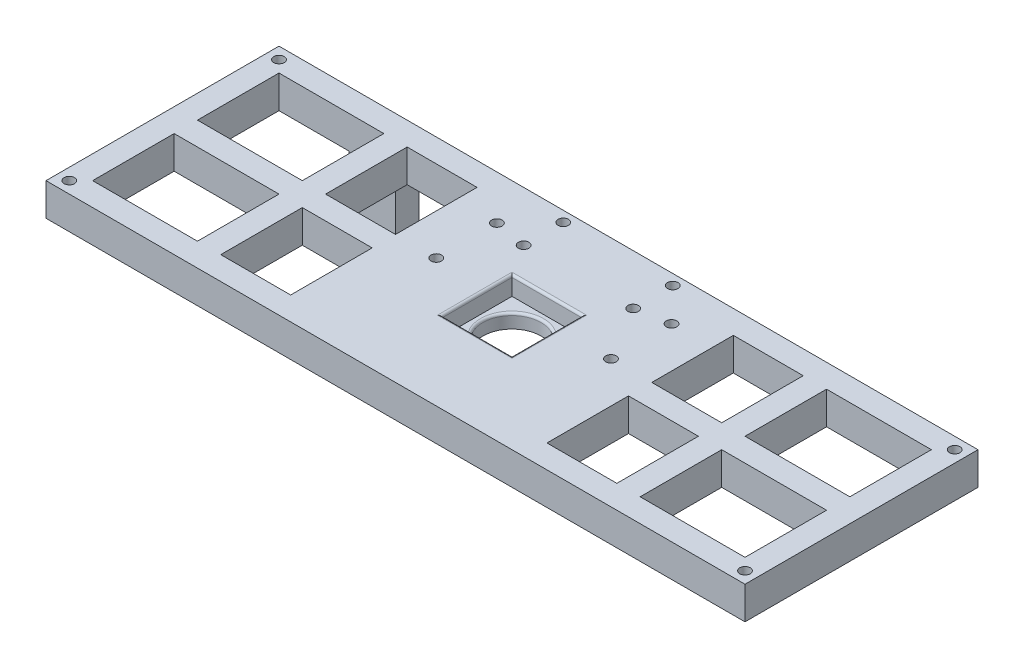
from build123d import *

# Parameters (mm, degrees)
SKETCH_1_W           = 300
SKETCH_1_H           = 100
EXTRUDE_1_DEPTH      = 16
SKETCH_2_W           = 30
SKETCH_2_H           = 30
CUT_EXTRUDE_1_DEPTH  = 8
SKETCH_3_R           = 12.5
CUT_EXTRUDE_2_DEPTH  = 14
CUT_EXTRUDE_3_REACH  = 318.632
SKETCH_4_W           = 50
SKETCH_4_H           = 35
SKETCH_7_W           = 35
SKETCH_7_H           = 16
EXTRUDE_2_DEPTH      = 20
SKETCH_8_W           = 35
SKETCH_8_H           = 16
EXTRUDE_3_DEPTH      = 20
SKETCH_9_W           = 20
SKETCH_9_H           = 10
EXTRUDE_4_DEPTH      = 25
FILLET_1_R           = 1
FILLET_2_R           = 1
SKETCH_13_W          = 35
SKETCH_13_H          = 16
EXTRUDE_6_DEPTH      = 4
SKETCH_14_W          = 35
SKETCH_14_H          = 16
EXTRUDE_7_DEPTH      = 4
SKETCH_17_W          = 35
SKETCH_17_H          = 16
EXTRUDE_8_DEPTH      = 1
SKETCH_18_W          = 35
SKETCH_18_H          = 16
EXTRUDE_9_DEPTH      = 1
SKETCH_19_R          = 2.25
CUT_EXTRUDE_8_DEPTH  = 5
CUT_EXTRUDE_START    = -7
SKETCH_20_R          = 2.25
CUT_EXTRUDE_9_DEPTH  = 7
SKETCH_21_R          = 1.45
CUT_EXTRUDE_10_DEPTH = 5
SKETCH_22_R          = 2.25
CUT_EXTRUDE_11_DEPTH = 5
SKETCH_23_R          = 1.45
CUT_EXTRUDE_12_DEPTH = 5
SKETCH_24_R          = 2.25
CUT_EXTRUDE_13_DEPTH = 5
CUT_EXTRUDE_15_DEPTH = 2
SKETCH_27_R          = 1.5
CUT_EXTRUDE_16_DEPTH = 4


with BuildPart() as part:
    # 草图1 → 凸台-拉伸1 (new body)
    with BuildSketch(Plane(origin=(0, 0, 0), x_dir=(1, 0, 0), z_dir=(0, 1, 0))):
        with Locations((-150, 50)):
            Rectangle(SKETCH_1_W, SKETCH_1_H)
    extrude(amount=EXTRUDE_1_DEPTH)

    # 草图2 → 切除-拉伸1 (cut)
    with BuildSketch(Plane(origin=(0, 16, 0), x_dir=(1, 0, 0), z_dir=(0, 1, 0))):
        with Locations((-150, 50)):
            Rectangle(SKETCH_2_W, SKETCH_2_H)
    extrude(amount=-CUT_EXTRUDE_1_DEPTH, mode=Mode.SUBTRACT)

    # 草图3 → 切除-拉伸2 (cut)
    with BuildSketch(Plane(origin=(0, 8, 0), x_dir=(1, 0, 0), z_dir=(0, 1, 0))):
        with Locations((-150, 50)):
            Circle(SKETCH_3_R)
    extrude(amount=-CUT_EXTRUDE_2_DEPTH, mode=Mode.SUBTRACT)

    # 草图4 → 切除-拉伸3 (cut, up to next)
    with BuildSketch(Plane(origin=(0, 16, 0), x_dir=(1, 0, 0), z_dir=(0, 1, 0)), mode=Mode.PRIVATE) as cut_extrude_3_sk1:
        with Locations((-270, 72.5)):
            Rectangle(SKETCH_4_W, SKETCH_4_H)
    cut_extrude_3_tool1 = extrude(cut_extrude_3_sk1.sketch, amount=-CUT_EXTRUDE_3_REACH, mode=Mode.PRIVATE) & part.part
    # 草图4 → 切除-拉伸3 (cut, up to next)
    with BuildSketch(Plane(origin=(0, 16, 0), x_dir=(1, 0, 0), z_dir=(0, 1, 0)), mode=Mode.PRIVATE) as cut_extrude_3_sk2:
        with Locations((-270, 27.5)):
            Rectangle(SKETCH_4_W, SKETCH_4_H)
    cut_extrude_3_tool2 = extrude(cut_extrude_3_sk2.sketch, amount=-CUT_EXTRUDE_3_REACH, mode=Mode.PRIVATE) & part.part
    # 草图4 → 切除-拉伸3 (cut, up to next)
    with BuildSketch(Plane(origin=(0, 16, 0), x_dir=(1, 0, 0), z_dir=(0, 1, 0)), mode=Mode.PRIVATE) as cut_extrude_3_sk3:
        with Locations((-210, 72.5)):
            Rectangle(SKETCH_4_W, SKETCH_4_H)
    cut_extrude_3_tool3 = extrude(cut_extrude_3_sk3.sketch, amount=-CUT_EXTRUDE_3_REACH, mode=Mode.PRIVATE) & part.part
    # 草图4 → 切除-拉伸3 (cut, up to next)
    with BuildSketch(Plane(origin=(0, 16, 0), x_dir=(1, 0, 0), z_dir=(0, 1, 0)), mode=Mode.PRIVATE) as cut_extrude_3_sk4:
        with Locations((-210, 27.5)):
            Rectangle(SKETCH_4_W, SKETCH_4_H)
    cut_extrude_3_tool4 = extrude(cut_extrude_3_sk4.sketch, amount=-CUT_EXTRUDE_3_REACH, mode=Mode.PRIVATE) & part.part
    # 草图4 → 切除-拉伸3 (cut, up to next)
    with BuildSketch(Plane(origin=(0, 16, 0), x_dir=(1, 0, 0), z_dir=(0, 1, 0)), mode=Mode.PRIVATE) as cut_extrude_3_sk5:
        with Locations((-30, 27.5)):
            Rectangle(SKETCH_4_W, SKETCH_4_H)
    cut_extrude_3_tool5 = extrude(cut_extrude_3_sk5.sketch, amount=-CUT_EXTRUDE_3_REACH, mode=Mode.PRIVATE) & part.part
    # 草图4 → 切除-拉伸3 (cut, up to next)
    with BuildSketch(Plane(origin=(0, 16, 0), x_dir=(1, 0, 0), z_dir=(0, 1, 0)), mode=Mode.PRIVATE) as cut_extrude_3_sk6:
        with Locations((-90, 27.5)):
            Rectangle(SKETCH_4_W, SKETCH_4_H)
    cut_extrude_3_tool6 = extrude(cut_extrude_3_sk6.sketch, amount=-CUT_EXTRUDE_3_REACH, mode=Mode.PRIVATE) & part.part
    # 草图4 → 切除-拉伸3 (cut, up to next)
    with BuildSketch(Plane(origin=(0, 16, 0), x_dir=(1, 0, 0), z_dir=(0, 1, 0)), mode=Mode.PRIVATE) as cut_extrude_3_sk7:
        with Locations((-90, 72.5)):
            Rectangle(SKETCH_4_W, SKETCH_4_H)
    cut_extrude_3_tool7 = extrude(cut_extrude_3_sk7.sketch, amount=-CUT_EXTRUDE_3_REACH, mode=Mode.PRIVATE) & part.part
    # 草图4 → 切除-拉伸3 (cut, up to next)
    with BuildSketch(Plane(origin=(0, 16, 0), x_dir=(1, 0, 0), z_dir=(0, 1, 0)), mode=Mode.PRIVATE) as cut_extrude_3_sk8:
        with Locations((-30, 72.5)):
            Rectangle(SKETCH_4_W, SKETCH_4_H)
    cut_extrude_3_tool8 = extrude(cut_extrude_3_sk8.sketch, amount=-CUT_EXTRUDE_3_REACH, mode=Mode.PRIVATE) & part.part
    add(cut_extrude_3_tool1.solids().sort_by_distance((-270, 16, -72.5))[0], mode=Mode.SUBTRACT)
    add(cut_extrude_3_tool2.solids().sort_by_distance((-270, 16, -27.5))[0], mode=Mode.SUBTRACT)
    add(cut_extrude_3_tool3.solids().sort_by_distance((-210, 16, -72.5))[0], mode=Mode.SUBTRACT)
    add(cut_extrude_3_tool4.solids().sort_by_distance((-210, 16, -27.5))[0], mode=Mode.SUBTRACT)
    add(cut_extrude_3_tool5.solids().sort_by_distance((-30, 16, -27.5))[0], mode=Mode.SUBTRACT)
    add(cut_extrude_3_tool6.solids().sort_by_distance((-90, 16, -27.5))[0], mode=Mode.SUBTRACT)
    add(cut_extrude_3_tool7.solids().sort_by_distance((-90, 16, -72.5))[0], mode=Mode.SUBTRACT)
    add(cut_extrude_3_tool8.solids().sort_by_distance((-30, 16, -72.5))[0], mode=Mode.SUBTRACT)

    # 草图7 → 凸台-拉伸2 (add)
    with BuildSketch(Plane.ZY.offset(185)):
        with Locations((-27.5, 8)):
            Rectangle(SKETCH_7_W, SKETCH_7_H)
        with Locations((-72.5, 8)):
            Rectangle(SKETCH_7_W, SKETCH_7_H)
    extrude(amount=EXTRUDE_2_DEPTH)

    # 草图8 → 凸台-拉伸3 (add)
    with BuildSketch(Plane(origin=(-115, 0, 0), x_dir=(0, 0, -1), z_dir=(1, 0, 0))):
        with Locations((27.5, 8)):
            Rectangle(SKETCH_8_W, SKETCH_8_H)
        with Locations((72.5, 8)):
            Rectangle(SKETCH_8_W, SKETCH_8_H)
    extrude(amount=EXTRUDE_3_DEPTH)

    # 草图9 → 凸台-拉伸4 (add)
    with BuildSketch(Plane.XZ):
        with Locations((-250, -95)):
            Rectangle(SKETCH_9_W, SKETCH_9_H)
    extrude(amount=EXTRUDE_4_DEPTH)

    # 圆角1
    fillet_1_edges = [part.edges().sort_by_distance(p)[0] for p in [
        (-162.5, 8, -50),
    ]]
    fillet(fillet_1_edges, radius=FILLET_1_R)

    # 圆角2
    fillet_2_edges = [part.edges().sort_by_distance(p)[0] for p in [
        (-135, 16, -50),
        (-150, 16, -65),
        (-150, 16, -35),
        (-165, 16, -50),
    ]]
    fillet(fillet_2_edges, radius=FILLET_2_R)

    # 草图13 → 凸台-拉伸6 (add)
    with BuildSketch(Plane.ZY.offset(5)):
        with Locations((-72.5, 8)):
            Rectangle(SKETCH_13_W, SKETCH_13_H)
        with Locations((-27.5, 8)):
            Rectangle(SKETCH_13_W, SKETCH_13_H)
    extrude(amount=EXTRUDE_6_DEPTH)

    # 草图14 → 凸台-拉伸7 (add)
    with BuildSketch(Plane(origin=(-295, 0, 0), x_dir=(0, 0, -1), z_dir=(1, 0, 0))):
        with Locations((72.5, 8)):
            Rectangle(SKETCH_14_W, SKETCH_14_H)
        with Locations((27.5, 8)):
            Rectangle(SKETCH_14_W, SKETCH_14_H)
    extrude(amount=EXTRUDE_7_DEPTH)

    # 草图17 → 凸台-拉伸8 (add)
    with BuildSketch(Plane(origin=(-291, 0, 0), x_dir=(0, 0, -1), z_dir=(1, 0, 0))):
        with Locations((27.5, 8)):
            Rectangle(SKETCH_17_W, SKETCH_17_H)
        with Locations((72.5, 8)):
            Rectangle(SKETCH_17_W, SKETCH_17_H)
    extrude(amount=EXTRUDE_8_DEPTH)

    # 草图18 → 凸台-拉伸9 (add)
    with BuildSketch(Plane.ZY.offset(9)):
        with Locations((-27.5, 8)):
            Rectangle(SKETCH_18_W, SKETCH_18_H)
        with Locations((-72.5, 8)):
            Rectangle(SKETCH_18_W, SKETCH_18_H)
    extrude(amount=EXTRUDE_9_DEPTH)

    # 草图19 → 切除-拉伸8 (cut)
    with BuildSketch(Plane(origin=(0, 16, 0), x_dir=(1, 0, 0), z_dir=(0, 1, 0))):
        with Locations((-295, 95)):
            Circle(SKETCH_19_R)
        with Locations((-295, 5)):
            Circle(SKETCH_19_R)
        with Locations((-5, 5)):
            Circle(SKETCH_19_R)
        with Locations((-5, 95)):
            Circle(SKETCH_19_R)
    extrude(amount=-CUT_EXTRUDE_8_DEPTH, mode=Mode.SUBTRACT)

    # 草图20 → 切除-拉伸9 (cut)
    with BuildSketch(Plane.XZ.offset(CUT_EXTRUDE_START)):
        with Locations((-295, -95)):
            Circle(SKETCH_20_R)
        with Locations((-295, -5)):
            Circle(SKETCH_20_R)
        with Locations((-5, -95)):
            Circle(SKETCH_20_R)
        with Locations((-5, -5)):
            Circle(SKETCH_20_R)
    extrude(amount=CUT_EXTRUDE_9_DEPTH, mode=Mode.SUBTRACT)

    # 草图21 → 切除-拉伸10 (cut)
    with BuildSketch(Plane(origin=(-100.276222054, 16, -200.091791604), x_dir=(-0.00184091553368713, 0, -0.9999983055135633), z_dir=(0, 1, 0))):
        with Locations((-104.543338614, 26.416278164)):
            Circle(SKETCH_21_R)
        with Locations((-121.543309808, 26.447573728)):
            Circle(SKETCH_21_R)
        with Locations((-121.456786778, 73.447494087)):
            Circle(SKETCH_21_R)
        with Locations((-104.456815584, 73.416198523)):
            Circle(SKETCH_21_R)
    extrude(amount=-CUT_EXTRUDE_10_DEPTH, mode=Mode.SUBTRACT)

    # 草图22 → 切除-拉伸11 (cut)
    with BuildSketch(Plane(origin=(0, 16, 0), x_dir=(1, 0, 0), z_dir=(0, 1, 0))):
        with Locations((-173.5, 95.5)):
            Circle(SKETCH_22_R)
        with Locations((-173.5, 78.5)):
            Circle(SKETCH_22_R)
        with Locations((-126.5, 95.5)):
            Circle(SKETCH_22_R)
        with Locations((-126.5, 78.5)):
            Circle(SKETCH_22_R)
    extrude(amount=-CUT_EXTRUDE_11_DEPTH, mode=Mode.SUBTRACT)

    # 草图23 → 切除-拉伸12 (cut)
    with BuildSketch(Plane(origin=(-100.276222054, 16, -200.091791604), x_dir=(-0.00184091553368713, 0, -0.9999983055135633), z_dir=(0, 1, 0))):
        with Locations((-119.069051565, 12.462168574)):
            Circle(SKETCH_23_R)
        with Locations((-145.069007508, 12.510032378)):
            Circle(SKETCH_23_R)
        with Locations((-144.931009437, 87.471558467)):
            Circle(SKETCH_23_R)
        with Locations((-118.931053493, 87.423694663)):
            Circle(SKETCH_23_R)
    extrude(amount=-CUT_EXTRUDE_12_DEPTH, mode=Mode.SUBTRACT)

    # 草图24 → 切除-拉伸13 (cut)
    with BuildSketch(Plane(origin=(0, 16, 0), x_dir=(1, 0, 0), z_dir=(0, 1, 0))):
        with Locations((-187.480826555, 81)):
            Circle(SKETCH_24_R)
        with Locations((-187.480826555, 55)):
            Circle(SKETCH_24_R)
        with Locations((-112.519173445, 81)):
            Circle(SKETCH_24_R)
        with Locations((-112.519173445, 55)):
            Circle(SKETCH_24_R)
    extrude(amount=-CUT_EXTRUDE_13_DEPTH, mode=Mode.SUBTRACT)

    # 草图26 → 切除-拉伸15 (cut)
    with BuildSketch(Plane.XZ):
        Polygon((-260, -90), (-290, -90), (-290, -55), (-245, -55), (-245, -90), (-240, -90), (-240, -100), (0, -100), (0, 0), (-300, 0), (-300, -100), (-260, -100), align=None)
    extrude(amount=-CUT_EXTRUDE_15_DEPTH, mode=Mode.SUBTRACT)

    # 草图27 → 切除-拉伸16 (cut)
    with BuildSketch(Plane(origin=(0, 11, 0), x_dir=(1, 0, 0), z_dir=(0, 1, 0))):
        with Locations((-173.5, 95.5)):
            Circle(SKETCH_27_R)
        with Locations((-187.480826555, 81)):
            Circle(SKETCH_27_R)
        with Locations((-173.5, 78.5)):
            Circle(SKETCH_27_R)
        with Locations((-126.5, 95.5)):
            Circle(SKETCH_27_R)
        with Locations((-126.5, 78.5)):
            Circle(SKETCH_27_R)
        with Locations((-187.480826555, 55)):
            Circle(SKETCH_27_R)
        with Locations((-112.519173445, 55)):
            Circle(SKETCH_27_R)
        with Locations((-112.519173445, 81)):
            Circle(SKETCH_27_R)
        with Locations((-5, 95)):
            Circle(SKETCH_27_R)
        with Locations((-5, 5)):
            Circle(SKETCH_27_R)
        with Locations((-295, 5)):
            Circle(SKETCH_27_R)
        with Locations((-295, 95)):
            Circle(SKETCH_27_R)
    extrude(amount=-CUT_EXTRUDE_16_DEPTH, mode=Mode.SUBTRACT)


solid = part.part
